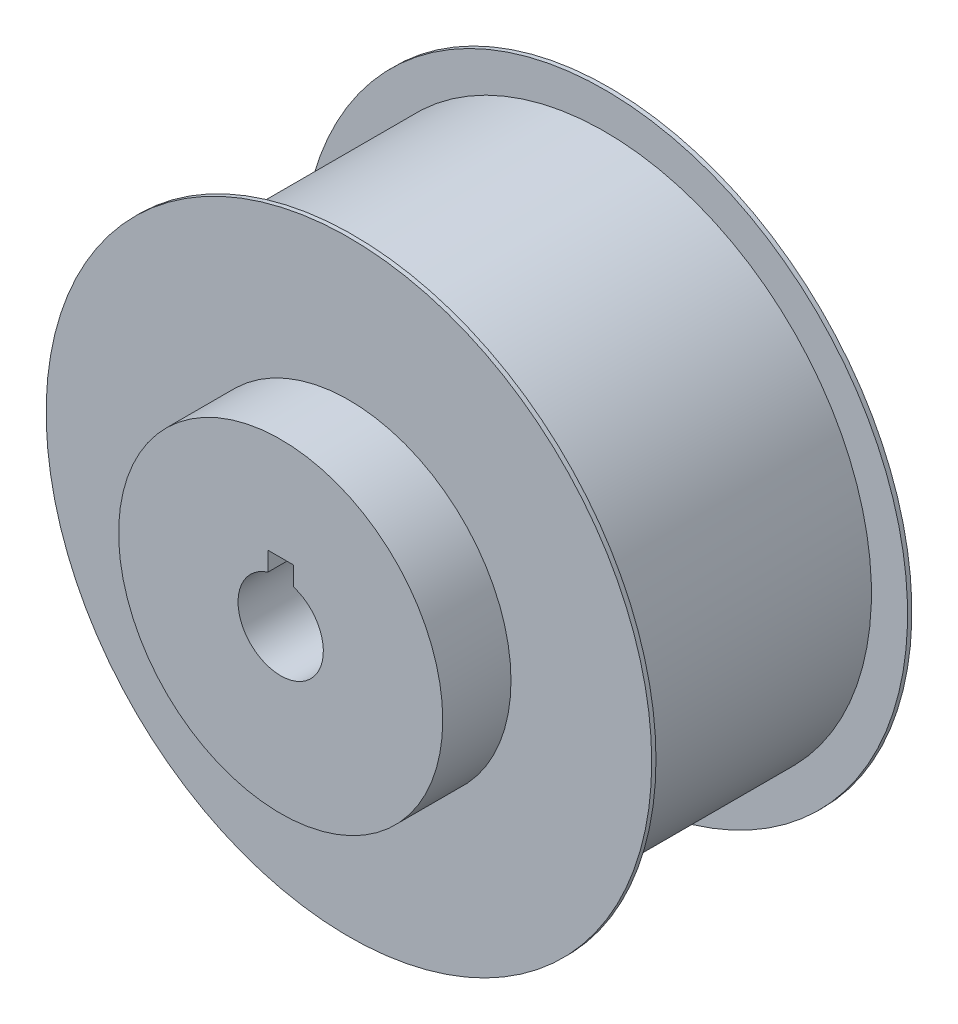
from build123d import *

# Parameters (mm, degrees)
SZKIC1_R                    = 31.26
DODANIE_WYCI_GNI_CIE1_DEPTH = 30.5
SZKIC2_R                    = 19
DODANIE_WYCI_GNI_CIE2_DEPTH = 8
SZKIC3_R                    = 35.5
DODANIE_WYCI_GNI_CIE3_DEPTH = 0.5
DODANIE_WYCI_GNI_CIE4_START = -0.5
SZKIC7_R                    = 35.5
DODANIE_WYCI_GNI_CIE4_DEPTH = 0.5
SZKIC5_R                    = 5
WYTNIJ_WYCI_GNI_CIE2_DEPTH  = 64.267290127
SZKIC6_W                    = 3
SZKIC6_H                    = 7
WYTNIJ_WYCI_GNI_CIE3_DEPTH  = 40


with BuildPart() as part:
    # Szkic1 → Dodanie-wyciągnięcie1 (new body)
    with BuildSketch(Plane.XY):
        Circle(SZKIC1_R)
    extrude(amount=DODANIE_WYCI_GNI_CIE1_DEPTH)

    # Szkic2 → Dodanie-wyciągnięcie2 (add)
    with BuildSketch(Plane.XY.offset(30.5)):
        Circle(SZKIC2_R)
    extrude(amount=DODANIE_WYCI_GNI_CIE2_DEPTH)

    # Szkic3 → Dodanie-wyciągnięcie3 (add)
    with BuildSketch(Plane.XY.offset(30.5)):
        Circle(SZKIC3_R)
    extrude(amount=-DODANIE_WYCI_GNI_CIE3_DEPTH)

    # Szkic7 → Dodanie-wyciągnięcie4 (add)
    with BuildSketch(Plane(origin=(0, 0, 0), x_dir=(-1, 0, 0), z_dir=(0, 0, -1)).offset(DODANIE_WYCI_GNI_CIE4_START)):
        Circle(SZKIC7_R)
    extrude(amount=DODANIE_WYCI_GNI_CIE4_DEPTH)

    # Szkic5 → Wytnij-wyciągnięcie2 (cut, through all)
    with BuildSketch(Plane.XY.offset(38.5)):
        Circle(SZKIC5_R)
    extrude(amount=-WYTNIJ_WYCI_GNI_CIE2_DEPTH, mode=Mode.SUBTRACT)

    # Szkic6 → Wytnij-wyciągnięcie3 (cut)
    with BuildSketch(Plane.XY.offset(38.5)):
        with Locations((0, 3.5)):
            Rectangle(SZKIC6_W, SZKIC6_H)
    extrude(amount=-WYTNIJ_WYCI_GNI_CIE3_DEPTH, mode=Mode.SUBTRACT)


solid = part.part
